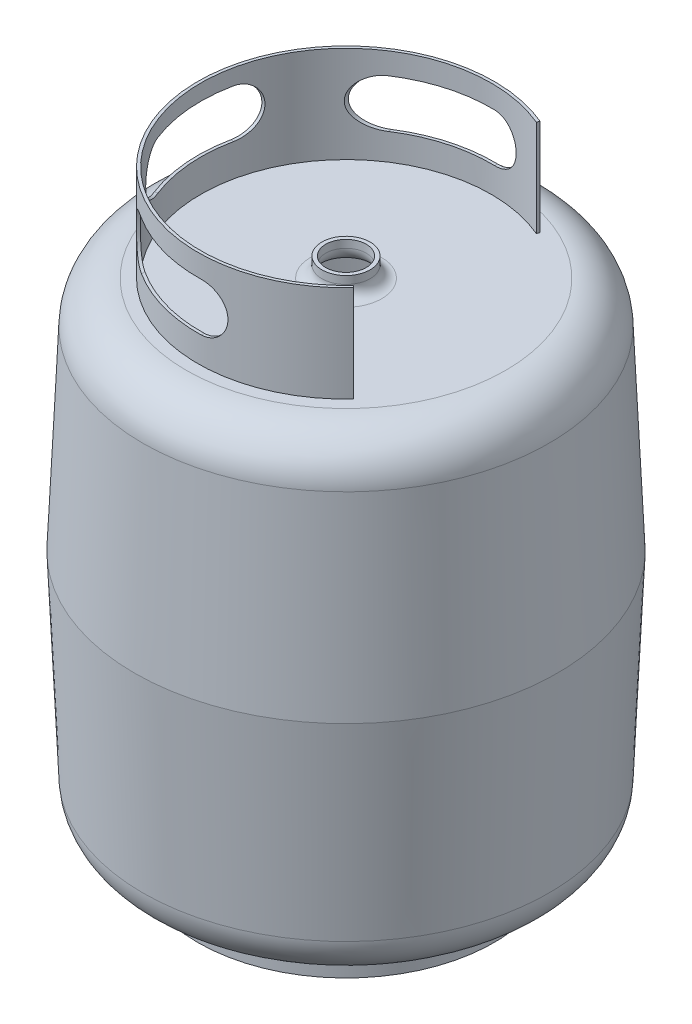
from build123d import *

# Parameters (mm, degrees)
CONG_1_R                     = 12
CONG_2_R                     = 45
CONG_3_R                     = 45
BOSS_EXTRU_1_DEPTH           = 100
ENL_V_MAT_EXTRU_1_DEPTH      = 470.112426245
ENL_V_MAT_EXTRU_1_DEPTH_BACK = 470.112426245
ENL_V_MAT_EXTRU_2_DEPTH      = 470.112426317
ENL_V_MAT_EXTRU_2_DEPTH_BACK = 470.112426317
BOSS_EXTRU_2_START           = 30
ESQUISSE7_R                  = 153.671871599
ESQUISSE7_R_2                = 150.671871599
BOSS_EXTRU_2_DEPTH           = 30


# Read off the part's stored shape, not the designer's step: Coque12
with BuildPart() as part:
    # Esquisse1 → Révolution2 (revolve)
    with BuildSketch(Plane.XY, mode=Mode.PRIVATE) as r_volution2_sk:
        Polygon((1.130942621, 254.067389771), (1.130942621, 234.067389771), (-182.619057379, 234.067389771), (-193.315988391, -10.932610229), (-182.619057379, -255.932610229), (26.130942621, -255.932610229), (26.130942621, 254.067389771), align=None)
    revolve(r_volution2_sk.sketch.rotate(Axis((26.130942621, -255.932610229, 0), (0, 1, 0)), 270), axis=Axis((26.130942621, -255.932610229, 0), (0, 1, 0)))

    # Congé1
    cong_1_edges = [part.edges().sort_by_distance(p)[0] for p in [
        (26.130942621, 234.067389771, 25),
    ]]
    fillet(cong_1_edges, radius=CONG_1_R)

    # Congé2
    cong_2_edges = [part.edges().sort_by_distance(p)[0] for p in [
        (26.130942621, 234.067389771, 208.75),
    ]]
    fillet(cong_2_edges, radius=CONG_2_R)

    # Congé3
    cong_3_edges = [part.edges().sort_by_distance(p)[0] for p in [
        (26.130942621, -255.932610229, 208.75),
    ]]
    fillet(cong_3_edges, radius=CONG_3_R)

    # Coque12 outline → Coque12 (revolve, cut)
    with BuildSketch(Plane(origin=(26.130942621, 0, 0), x_dir=(1, 0, 0), z_dir=(0, 0, 1))):
        with BuildLine():
            Line((0, 254.067389771), (0, -251.932610229))
            Line((0, -251.932610229), (165.671871599, -251.932610229))
            ThreePointArc((165.671871599, -251.932610229), (194.023906886, -240.549532673), (206.632848683, -212.721005111))
            Line((206.632848683, -212.721005111), (215.443120272, -10.932610229))
            Line((215.443120272, -10.932610229), (206.632848683, 190.855784653))
            ThreePointArc((206.632848683, 190.855784653), (194.023906886, 218.684312216), (165.671871599, 230.067389771))
            Line((165.671871599, 230.067389771), (37, 230.067389771))
            ThreePointArc((37, 230.067389771), (25.686291501, 234.753681272), (21, 246.067389771))
            Line((21, 246.067389771), (21, 254.067389771))
            Line((21, 254.067389771), (0, 254.067389771))
        make_face()
    revolve(axis=Axis((26.130942621, 0, 0), (0, 1, 0)), mode=Mode.SUBTRACT)

    # Esquisse2 → Boss.-Extru.1 (add)
    with BuildSketch(Plane(origin=(0, 234.067389771, 0), x_dir=(1, 0, 0), z_dir=(0, 1, 0))):
        with BuildLine():
            Line((84.724697989, 138.812048191), (85.891347505, 141.575909422))
            ThreePointArc((85.891347505, 141.575909422), (-124.118413072, -32.251747772), (138.729517743, -104.578224316))
            Line((138.729517743, -104.578224316), (136.531355374, -102.536636161))
            ThreePointArc((136.531355374, -102.536636161), (-121.185227822, -31.622125432), (84.724697989, 138.812048191))
        make_face()
    extrude(amount=BOSS_EXTRU_1_DEPTH)

    # Esquisse5 → Enlèv. mat.-Extru.1 (cut, two sides: drawn at the far end of the back side and taken through both)
    with BuildSketch(Plane(origin=(0, 0, 0), x_dir=(0, 0, -1), z_dir=(1, 0, 0)).offset(-ENL_V_MAT_EXTRU_1_DEPTH_BACK)):
        with BuildLine():
            Line((-55.116460289, 317.639998061), (30.883539711, 317.639998061))
            ThreePointArc((30.883539711, 317.639998061), (55.883539711, 292.639998061), (30.883539711, 267.639998061))
            Line((30.883539711, 267.639998061), (-55.116460289, 267.639998061))
            ThreePointArc((-55.116460289, 267.639998061), (-80.116460289, 292.639998061), (-55.116460289, 317.639998061))
        make_face()
    extrude(amount=ENL_V_MAT_EXTRU_1_DEPTH + ENL_V_MAT_EXTRU_1_DEPTH_BACK, mode=Mode.SUBTRACT)

    # Esquisse6 → Enlèv. mat.-Extru.2 (cut, two sides: drawn at the far end of the back side and taken through both)
    with BuildSketch(Plane.XY.offset(-ENL_V_MAT_EXTRU_2_DEPTH_BACK)):
        with BuildLine():
            Line((-56.317562024, 311.618184989), (29.682437976, 311.618184989))
            ThreePointArc((29.682437976, 311.618184989), (54.682437976, 286.618184989), (29.682437976, 261.618184989))
            Line((29.682437976, 261.618184989), (-56.317562024, 261.618184989))
            ThreePointArc((-56.317562024, 261.618184989), (-81.317562024, 286.618184989), (-56.317562024, 311.618184989))
        make_face()
    extrude(amount=ENL_V_MAT_EXTRU_2_DEPTH + ENL_V_MAT_EXTRU_2_DEPTH_BACK, mode=Mode.SUBTRACT)

    # Esquisse7 → Boss.-Extru.2 (add)
    with BuildSketch(Plane.XZ.offset(255.932610229).offset(BOSS_EXTRU_2_START)):
        with Locations(Location((26.130942621, 0, 0), (0, 0, 90))):
            Circle(ESQUISSE7_R)
        with Locations(Location((26.130942621, 0, 0), (0, 0, 270))):
            Circle(ESQUISSE7_R_2, mode=Mode.SUBTRACT)
    extrude(amount=-BOSS_EXTRU_2_DEPTH)


solid = part.part
